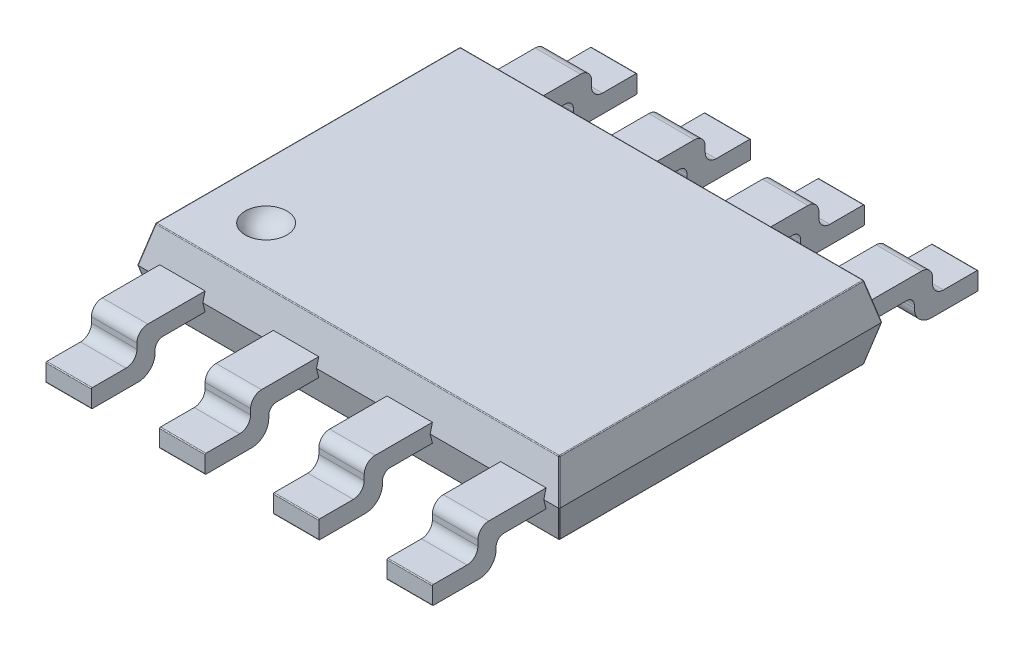
from build123d import *

# Parameters (mm, degrees)
SKETCH1_W               = 4.64
SKETCH1_H               = 3.55
BOSS_EXTRUDE1_DEPTH     = 0.4
CUT_EXTRUDE1_DEPTH      = 5.98399689
CUT_EXTRUDE2_DEPTH      = 3.94839363
CUT_EXTRUDE2_DEPTH_BACK = 3.94839363
FILLET1_R               = 0.01
BOSS_EXTRUDE2_START     = -0.6
BOSS_EXTRUDE2_DEPTH     = 0.25
FILLET2_R               = 0.01
LPATTERN1_COUNT         = 3
LPATTERN1_PITCH         = 1.25
LPATTERN1_COUNT_DIR2    = 2
LPATTERN1_PITCH_DIR2    = 1.25
MIRROR1_START           = -0.6
MIRROR1_COPY_1_DEPTH    = 0.25
MIRROR1_COPY_2_DEPTH    = 0.25
MIRROR1_COPY_3_DEPTH    = 0.25
MIRROR1_COPY_4_DEPTH    = 0.25
MIRROR1_COPY_5_DEPTH    = 0.25
MIRROR1_COPY_6_DEPTH    = 0.25


with BuildPart() as part:
    # Sketch1 → Boss-Extrude1 (new, symmetric)
    with BuildSketch(Plane(origin=(0, 0, 0), x_dir=(1, 0, 0), z_dir=(0, 1, 0))):
        Rectangle(SKETCH1_W, SKETCH1_H)
    extrude(amount=BOSS_EXTRUDE1_DEPTH, both=True)

    # Sketch2 → Cut-Extrude1 (cut, through all)
    with BuildSketch(Plane(origin=(2.32, 0, 0), x_dir=(0, 0, -1), z_dir=(1, 0, 0))):
        Polygon((-1.775, 0), (-1.775, -0.4), (-1.675, -0.4), align=None)
        Polygon((-1.775, 0.4), (-1.775, 0), (-1.675, 0.4), align=None)
        Polygon((1.775, 0), (1.675, -0.4), (1.775, -0.4), align=None)
        Polygon((1.775, 0.4), (1.675, 0.4), (1.775, 0), align=None)
    extrude(amount=-CUT_EXTRUDE1_DEPTH, mode=Mode.SUBTRACT)

    # Sketch3 → Cut-Extrude2 (cut, two sides: drawn at the far end of the back side and taken through both)
    with BuildSketch(Plane.XY.offset(-CUT_EXTRUDE2_DEPTH_BACK)):
        Polygon((-2.32, 0.4), (-2.32, 0), (-2.22, 0.4), align=None)
        Polygon((-2.22, -0.4), (-2.32, 0), (-2.32, -0.4), align=None)
        Polygon((2.32, -0.4), (2.32, 0), (2.22, -0.4), align=None)
        Polygon((2.22, 0.4), (2.32, 0), (2.32, 0.4), align=None)
    extrude(amount=CUT_EXTRUDE2_DEPTH + CUT_EXTRUDE2_DEPTH_BACK, mode=Mode.SUBTRACT)

    # Fillet1
    fillet1_edges = [part.edges().sort_by_distance(p)[0] for p in [
        (0, -0.4, -1.675),
        (2.27, 0.2, -1.725),
        (2.27, -0.2, -1.725),
        (2.22, -0.4, 0),
        (2.27, -0.2, 1.725),
        (2.27, 0.2, 1.725),
        (-2.27, -0.2, -1.725),
        (-2.27, 0.2, -1.725),
        (-2.22, -0.4, 0),
        (0, -0.4, 1.675),
        (-2.27, -0.2, 1.725),
        (-2.27, 0.2, 1.725),
        (0, 0.4, -1.675),
        (0, 0.4, 1.675),
        (-2.22, 0.4, 0),
        (2.22, 0.4, 0),
    ]]
    fillet(fillet1_edges, radius=FILLET1_R)

    # Sketch4 → Boss-Extrude2 (add, symmetric)
    with BuildSketch(Plane(origin=(0, 0, 0), x_dir=(0, 0, -1), z_dir=(1, 0, 0)).offset(BOSS_EXTRUDE2_START)):
        with BuildLine():
            Line((-1.75, 0.1), (-2.38, 0.1))
            ThreePointArc((-2.38, 0.1), (-2.464852814, 0.064852814), (-2.5, -0.02))
            Line((-2.5, -0.02), (-2.5, -0.08))
            ThreePointArc((-2.5, -0.08), (-2.535147186, -0.164852814), (-2.62, -0.2))
            Line((-2.62, -0.2), (-2.99, -0.2))
            ThreePointArc((-2.99, -0.2), (-2.997071068, -0.202928932), (-3, -0.21))
            Line((-3, -0.21), (-3, -0.39))
            ThreePointArc((-3, -0.39), (-2.997071068, -0.397071068), (-2.99, -0.4))
            Line((-2.99, -0.4), (-2.486242483, -0.4))
            ThreePointArc((-2.486242483, -0.4), (-2.35454916, -0.34545084), (-2.3, -0.213757517))
            Line((-2.3, -0.213757517), (-2.3, -0.185907519))
            ThreePointArc((-2.3, -0.185907519), (-2.27483827, -0.12516173), (-2.214092481, -0.1))
            Line((-2.214092481, -0.1), (-1.75, -0.1))
            Line((-1.75, -0.1), (-1.775, 0))
            Line((-1.775, 0), (-1.75, 0.1))
        make_face()
    boss_extrude2 = extrude(amount=BOSS_EXTRUDE2_DEPTH, both=True)

    # Fillet2
    fillet2_edges = [part.edges().sort_by_distance(p)[0] for p in [
        (-0.85, 0.1, 2.065),
        (-0.85, 0.064852814, 2.464852814),
        (-0.85, -0.05, 2.5),
        (-0.85, -0.164852814, 2.535147186),
        (-0.85, -0.2, 2.805),
        (-0.85, -0.202928932, 2.997071068),
        (-0.85, -0.1, 1.982046241),
        (-0.85, -0.12516173, 2.27483827),
        (-0.85, -0.199832518, 2.3),
        (-0.85, -0.34545084, 2.35454916),
        (-0.85, -0.4, 2.738121241),
        (-0.85, -0.397071068, 2.997071068),
        (-0.35, 0.1, 2.065),
        (-0.35, 0.064852814, 2.464852814),
        (-0.35, -0.05, 2.5),
        (-0.35, -0.164852814, 2.535147186),
        (-0.35, -0.2, 2.805),
        (-0.35, -0.202928932, 2.997071068),
        (-0.35, -0.1, 1.982046241),
        (-0.35, -0.12516173, 2.27483827),
        (-0.35, -0.199832518, 2.3),
        (-0.35, -0.34545084, 2.35454916),
        (-0.35, -0.4, 2.738121241),
        (-0.35, -0.397071068, 2.997071068),
        (-0.85, -0.3, 3),
        (-0.35, -0.3, 3),
    ]]
    fillet(fillet2_edges, radius=FILLET2_R)

    # LPattern1: Boss-Extrude2 3 × 2
    with Locations(*[Vector(1, 0, 0) * (i * LPATTERN1_PITCH) + Vector(-1, 0, 0) * (j * LPATTERN1_PITCH_DIR2) for i in range(LPATTERN1_COUNT) for j in range(LPATTERN1_COUNT_DIR2) if (i, j) != (0, 0)]):
        add(boss_extrude2)

    # Mirror1 copy 1 sketch → Mirror1 copy 1 (add, symmetric)
    with BuildSketch(Plane(origin=(-1.25, 0, 0), x_dir=(0, 0, 1), z_dir=(1, 0, 0)).offset(MIRROR1_START)):
        with BuildLine():
            Line((-1.75, -0.1), (-2.38, -0.1))
            ThreePointArc((-2.38, -0.1), (-2.464852814, -0.064852814), (-2.5, 0.02))
            Line((-2.5, 0.02), (-2.5, 0.08))
            ThreePointArc((-2.5, 0.08), (-2.535147186, 0.164852814), (-2.62, 0.2))
            Line((-2.62, 0.2), (-2.99, 0.2))
            ThreePointArc((-2.99, 0.2), (-2.997071068, 0.202928932), (-3, 0.21))
            Line((-3, 0.21), (-3, 0.39))
            ThreePointArc((-3, 0.39), (-2.997071068, 0.397071068), (-2.99, 0.4))
            Line((-2.99, 0.4), (-2.486242483, 0.4))
            ThreePointArc((-2.486242483, 0.4), (-2.35454916, 0.34545084), (-2.3, 0.213757517))
            Line((-2.3, 0.213757517), (-2.3, 0.185907519))
            ThreePointArc((-2.3, 0.185907519), (-2.27483827, 0.12516173), (-2.214092481, 0.1))
            Line((-2.214092481, 0.1), (-1.75, 0.1))
            Line((-1.75, 0.1), (-1.775, 0))
            Line((-1.775, 0), (-1.75, -0.1))
        make_face()
    extrude(amount=MIRROR1_COPY_1_DEPTH, both=True)

    # Mirror1 copy 2 sketch → Mirror1 copy 2 (add, symmetric)
    with BuildSketch(Plane(origin=(1.25, 0, 0), x_dir=(0, 0, 1), z_dir=(1, 0, 0)).offset(MIRROR1_START)):
        with BuildLine():
            Line((-1.75, -0.1), (-2.38, -0.1))
            ThreePointArc((-2.38, -0.1), (-2.464852814, -0.064852814), (-2.5, 0.02))
            Line((-2.5, 0.02), (-2.5, 0.08))
            ThreePointArc((-2.5, 0.08), (-2.535147186, 0.164852814), (-2.62, 0.2))
            Line((-2.62, 0.2), (-2.99, 0.2))
            ThreePointArc((-2.99, 0.2), (-2.997071068, 0.202928932), (-3, 0.21))
            Line((-3, 0.21), (-3, 0.39))
            ThreePointArc((-3, 0.39), (-2.997071068, 0.397071068), (-2.99, 0.4))
            Line((-2.99, 0.4), (-2.486242483, 0.4))
            ThreePointArc((-2.486242483, 0.4), (-2.35454916, 0.34545084), (-2.3, 0.213757517))
            Line((-2.3, 0.213757517), (-2.3, 0.185907519))
            ThreePointArc((-2.3, 0.185907519), (-2.27483827, 0.12516173), (-2.214092481, 0.1))
            Line((-2.214092481, 0.1), (-1.75, 0.1))
            Line((-1.75, 0.1), (-1.775, 0))
            Line((-1.775, 0), (-1.75, -0.1))
        make_face()
    extrude(amount=MIRROR1_COPY_2_DEPTH, both=True)

    # Mirror1 copy 3 sketch → Mirror1 copy 3 (add, symmetric)
    with BuildSketch(Plane(origin=(0, 0, 0), x_dir=(0, 0, 1), z_dir=(1, 0, 0)).offset(MIRROR1_START)):
        with BuildLine():
            Line((-1.75, -0.1), (-2.38, -0.1))
            ThreePointArc((-2.38, -0.1), (-2.464852814, -0.064852814), (-2.5, 0.02))
            Line((-2.5, 0.02), (-2.5, 0.08))
            ThreePointArc((-2.5, 0.08), (-2.535147186, 0.164852814), (-2.62, 0.2))
            Line((-2.62, 0.2), (-2.99, 0.2))
            ThreePointArc((-2.99, 0.2), (-2.997071068, 0.202928932), (-3, 0.21))
            Line((-3, 0.21), (-3, 0.39))
            ThreePointArc((-3, 0.39), (-2.997071068, 0.397071068), (-2.99, 0.4))
            Line((-2.99, 0.4), (-2.486242483, 0.4))
            ThreePointArc((-2.486242483, 0.4), (-2.35454916, 0.34545084), (-2.3, 0.213757517))
            Line((-2.3, 0.213757517), (-2.3, 0.185907519))
            ThreePointArc((-2.3, 0.185907519), (-2.27483827, 0.12516173), (-2.214092481, 0.1))
            Line((-2.214092481, 0.1), (-1.75, 0.1))
            Line((-1.75, 0.1), (-1.775, 0))
            Line((-1.775, 0), (-1.75, -0.1))
        make_face()
    extrude(amount=MIRROR1_COPY_3_DEPTH, both=True)

    # Mirror1 copy 4 sketch → Mirror1 copy 4 (add, symmetric)
    with BuildSketch(Plane(origin=(2.5, 0, 0), x_dir=(0, 0, 1), z_dir=(1, 0, 0)).offset(MIRROR1_START)):
        with BuildLine():
            Line((-1.75, -0.1), (-2.38, -0.1))
            ThreePointArc((-2.38, -0.1), (-2.464852814, -0.064852814), (-2.5, 0.02))
            Line((-2.5, 0.02), (-2.5, 0.08))
            ThreePointArc((-2.5, 0.08), (-2.535147186, 0.164852814), (-2.62, 0.2))
            Line((-2.62, 0.2), (-2.99, 0.2))
            ThreePointArc((-2.99, 0.2), (-2.997071068, 0.202928932), (-3, 0.21))
            Line((-3, 0.21), (-3, 0.39))
            ThreePointArc((-3, 0.39), (-2.997071068, 0.397071068), (-2.99, 0.4))
            Line((-2.99, 0.4), (-2.486242483, 0.4))
            ThreePointArc((-2.486242483, 0.4), (-2.35454916, 0.34545084), (-2.3, 0.213757517))
            Line((-2.3, 0.213757517), (-2.3, 0.185907519))
            ThreePointArc((-2.3, 0.185907519), (-2.27483827, 0.12516173), (-2.214092481, 0.1))
            Line((-2.214092481, 0.1), (-1.75, 0.1))
            Line((-1.75, 0.1), (-1.775, 0))
            Line((-1.775, 0), (-1.75, -0.1))
        make_face()
    extrude(amount=MIRROR1_COPY_4_DEPTH, both=True)

    # Mirror1 copy 5 sketch → Mirror1 copy 5 (add, symmetric)
    with BuildSketch(Plane(origin=(1.25, 0, 0), x_dir=(0, 0, 1), z_dir=(1, 0, 0)).offset(MIRROR1_START)):
        with BuildLine():
            Line((-1.75, -0.1), (-2.38, -0.1))
            ThreePointArc((-2.38, -0.1), (-2.464852814, -0.064852814), (-2.5, 0.02))
            Line((-2.5, 0.02), (-2.5, 0.08))
            ThreePointArc((-2.5, 0.08), (-2.535147186, 0.164852814), (-2.62, 0.2))
            Line((-2.62, 0.2), (-2.99, 0.2))
            ThreePointArc((-2.99, 0.2), (-2.997071068, 0.202928932), (-3, 0.21))
            Line((-3, 0.21), (-3, 0.39))
            ThreePointArc((-3, 0.39), (-2.997071068, 0.397071068), (-2.99, 0.4))
            Line((-2.99, 0.4), (-2.486242483, 0.4))
            ThreePointArc((-2.486242483, 0.4), (-2.35454916, 0.34545084), (-2.3, 0.213757517))
            Line((-2.3, 0.213757517), (-2.3, 0.185907519))
            ThreePointArc((-2.3, 0.185907519), (-2.27483827, 0.12516173), (-2.214092481, 0.1))
            Line((-2.214092481, 0.1), (-1.75, 0.1))
            Line((-1.75, 0.1), (-1.775, 0))
            Line((-1.775, 0), (-1.75, -0.1))
        make_face()
    extrude(amount=MIRROR1_COPY_5_DEPTH, both=True)

    # Mirror1 copy 6 sketch → Mirror1 copy 6 (add, symmetric)
    with BuildSketch(Plane(origin=(0, 0, 0), x_dir=(0, 0, 1), z_dir=(1, 0, 0)).offset(MIRROR1_START)):
        with BuildLine():
            Line((-1.75, -0.1), (-2.38, -0.1))
            ThreePointArc((-2.38, -0.1), (-2.464852814, -0.064852814), (-2.5, 0.02))
            Line((-2.5, 0.02), (-2.5, 0.08))
            ThreePointArc((-2.5, 0.08), (-2.535147186, 0.164852814), (-2.62, 0.2))
            Line((-2.62, 0.2), (-2.99, 0.2))
            ThreePointArc((-2.99, 0.2), (-2.997071068, 0.202928932), (-3, 0.21))
            Line((-3, 0.21), (-3, 0.39))
            ThreePointArc((-3, 0.39), (-2.997071068, 0.397071068), (-2.99, 0.4))
            Line((-2.99, 0.4), (-2.486242483, 0.4))
            ThreePointArc((-2.486242483, 0.4), (-2.35454916, 0.34545084), (-2.3, 0.213757517))
            Line((-2.3, 0.213757517), (-2.3, 0.185907519))
            ThreePointArc((-2.3, 0.185907519), (-2.27483827, 0.12516173), (-2.214092481, 0.1))
            Line((-2.214092481, 0.1), (-1.75, 0.1))
            Line((-1.75, 0.1), (-1.775, 0))
            Line((-1.775, 0), (-1.75, -0.1))
        make_face()
    extrude(amount=MIRROR1_COPY_6_DEPTH, both=True)

    # Sketch5 → Cut-Revolve1 (revolve, cut)
    with BuildSketch(Plane(origin=(0, 0.5, 0), x_dir=(1, 0, 0), z_dir=(0, 1, 0))):
        with BuildLine():
            Line((-1.362192236, -1.067192236), (-1.862192236, -1.067192236))
            ThreePointArc((-1.862192236, -1.067192236), (-1.612192236, -0.817192236), (-1.362192236, -1.067192236))
        make_face()
    revolve(axis=Axis((-1.362192236, 0.5, 1.067192236), (-1, 0, 0)), mode=Mode.SUBTRACT)


solid = part.part
